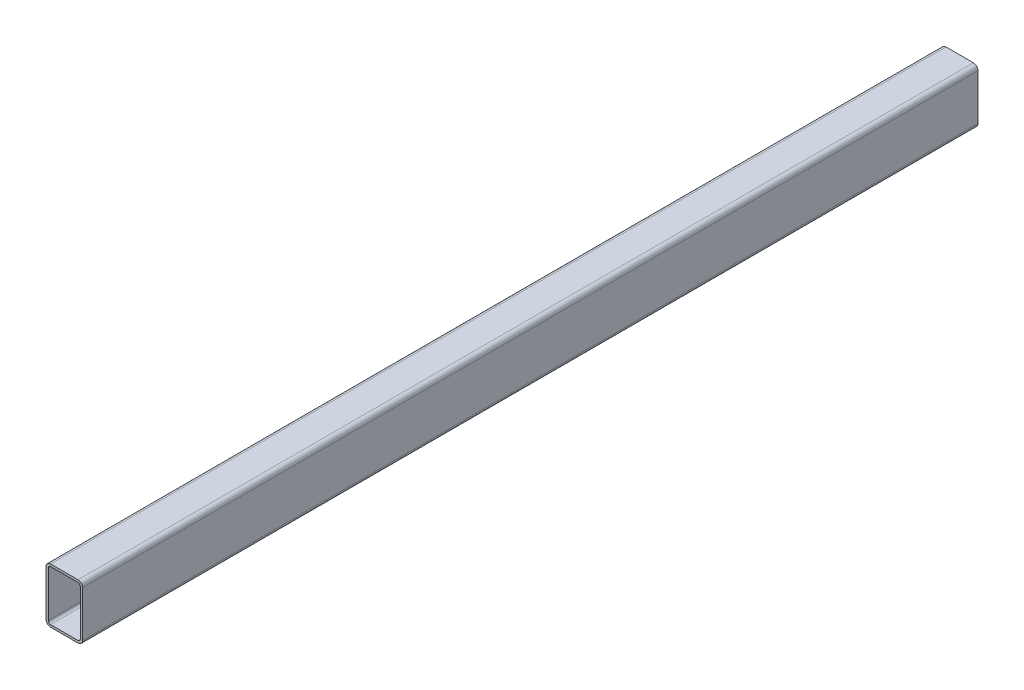
from build123d import *

# Parameters (mm, degrees)
BOSS_EXTRUDE2_DEPTH = 622.3


with BuildPart() as part:
    # Sketch13 → Boss-Extrude2 (new, symmetric)
    with BuildSketch(Plane.XY):
        with BuildLine():
            Line((19.05, -38.1), (-19.05, -38.1))
            ThreePointArc((-19.05, -38.1), (-23.540128061, -36.240128061), (-25.4, -31.75))
            Line((-25.4, -31.75), (-25.4, 31.75))
            ThreePointArc((-25.4, 31.75), (-23.540128061, 36.240128061), (-19.05, 38.1))
            Line((-19.05, 38.1), (19.05, 38.1))
            ThreePointArc((19.05, 38.1), (23.540128061, 36.240128061), (25.4, 31.75))
            Line((25.4, 31.75), (25.4, -31.75))
            ThreePointArc((25.4, -31.75), (23.540128061, -36.240128061), (19.05, -38.1))
        make_face()
        with BuildLine():
            Line((19.05, -34.925), (-19.05, -34.925))
            ThreePointArc((-19.05, -34.925), (-21.29506403, -33.99506403), (-22.225, -31.75))
            Line((-22.225, -31.75), (-22.225, 31.75))
            ThreePointArc((-22.225, 31.75), (-21.29506403, 33.99506403), (-19.05, 34.925))
            Line((-19.05, 34.925), (19.05, 34.925))
            ThreePointArc((19.05, 34.925), (21.29506403, 33.99506403), (22.225, 31.75))
            Line((22.225, 31.75), (22.225, -31.75))
            ThreePointArc((22.225, -31.75), (21.29506403, -33.99506403), (19.05, -34.925))
        make_face(mode=Mode.SUBTRACT)
    extrude(amount=BOSS_EXTRUDE2_DEPTH, both=True)


solid = part.part
